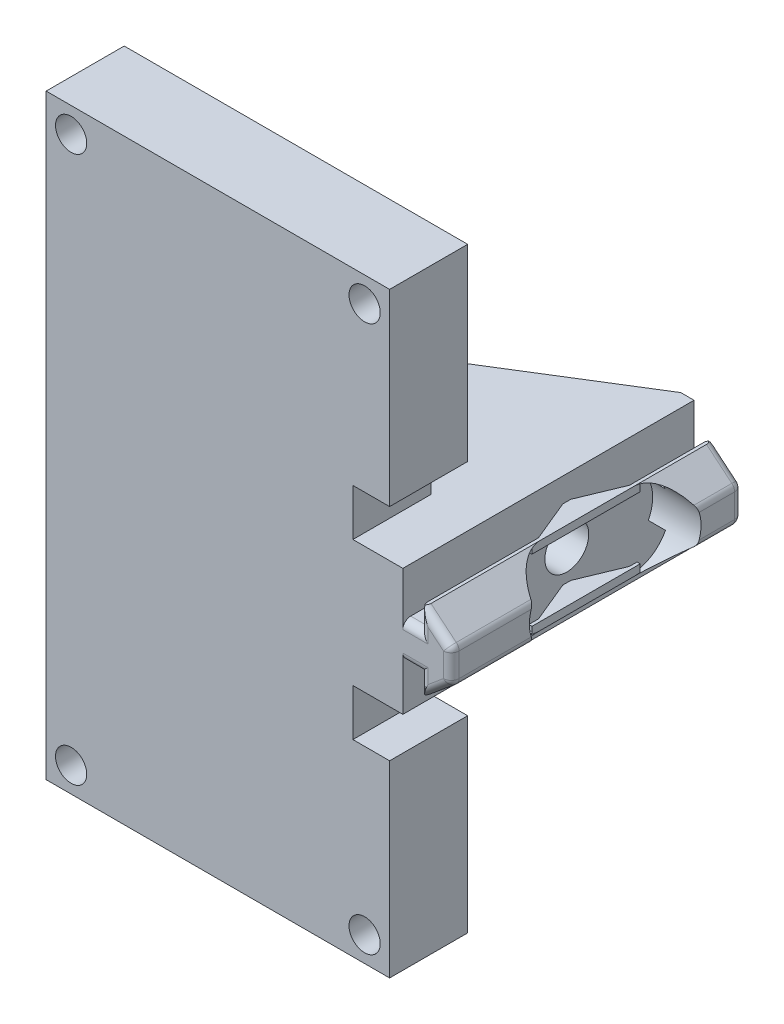
from build123d import *

# Parameters (mm, degrees)
BOSS_EXTRUDE1_DEPTH                              = 47.371
SKETCH2_W                                        = 6.858
SKETCH2_H                                        = 3.429
CUT_EXTRUDE1_DEPTH                               = 49.438972089
SKETCH3_W                                        = 4.064
SKETCH3_H                                        = 47.371
BOSS_EXTRUDE2_DEPTH                              = 7.366
SKETCH4_W                                        = 6.858
SKETCH4_H                                        = 3.429
CUT_EXTRUDE2_DEPTH                               = 50.110425431
SKETCH5_W                                        = 4.064
SKETCH5_H                                        = 47.371
BOSS_EXTRUDE3_DEPTH                              = 7.366
FILLET1_R                                        = 1.27
FILLET3_R                                        = 1.27
FILLET5_R                                        = 1.27
SKETCH15_W                                       = 47.371
SKETCH15_H                                       = 20.574
CUT_EXTRUDE3_DEPTH                               = 1.905
SKETCH16_W                                       = 55.88
SKETCH16_H                                       = 97.028
BOSS_EXTRUDE4_DEPTH                              = 12.7
SKETCH17_R                                       = 2.54
SKETCH17_W                                       = 8.128
SKETCH17_H                                       = 7.62
CUT_EXTRUDE4_DEPTH                               = 90.253265251
BOSS_EXTRUDE5_DEPTH                              = 10.287
BOSS_EXTRUDE5_DEPTH_BACK                         = 10.287
CUT_EXTRUDE5_DEPTH                               = 80.266238887
BOSS_EXTRUDE6_DEPTH                              = 1.27
BOSS_EXTRUDE7_START                              = -12.7
BOSS_EXTRUDE7_DEPTH                              = 1.27
FILLET6_R                                        = 0.254
CBORE_FOR_1_4_BUTTON_HEAD_CAP_SCREW1_D           = 7.14248
CBORE_FOR_1_4_BUTTON_HEAD_CAP_SCREW1_CBORE_D     = 11.90752
CBORE_FOR_1_4_BUTTON_HEAD_CAP_SCREW1_CBORE_DEPTH = 38.1


with BuildPart() as part:
    # Sketch1 → Boss-Extrude1 (new body)
    with BuildSketch(Plane.XY.offset(23.6855)):
        Polygon((3.302, 6.35), (-4.064, 6.35), (-4.064, -6.35), (3.302, -6.35), (7.874, -2.54), (7.874, 2.54), align=None)
    extrude(amount=-BOSS_EXTRUDE1_DEPTH)

    # Sketch2 → Cut-Extrude1 (cut, through all)
    with BuildSketch(Plane.XY.offset(23.6855)):
        with Locations((-0.635, 4.6355)):
            Rectangle(SKETCH2_W, SKETCH2_H)
    extrude(amount=-CUT_EXTRUDE1_DEPTH, mode=Mode.SUBTRACT)

    # Sketch3 → Boss-Extrude2 (add)
    with BuildSketch(Plane(origin=(0, 2.921, 0), x_dir=(-1, 0, 0), z_dir=(0, 1, 0))):
        with Locations((2.032, 0)):
            Rectangle(SKETCH3_W, SKETCH3_H)
    extrude(amount=BOSS_EXTRUDE2_DEPTH)

    # Sketch4 → Cut-Extrude2 (cut, through all)
    with BuildSketch(Plane.XY.offset(23.6855)):
        with Locations((-0.635, -4.6355)):
            Rectangle(SKETCH4_W, SKETCH4_H)
    extrude(amount=-CUT_EXTRUDE2_DEPTH, mode=Mode.SUBTRACT)

    # Sketch5 → Boss-Extrude3 (add)
    with BuildSketch(Plane.XZ.offset(2.921)):
        with Locations((-2.032, 0)):
            Rectangle(SKETCH5_W, SKETCH5_H)
    extrude(amount=BOSS_EXTRUDE3_DEPTH)

    # Fillet1
    fillet1_edges = [part.edges().sort_by_distance(p)[0] for p in [
        (7.874, 2.54, 0),
        (7.874, -2.54, 0),
    ]]
    fillet(fillet1_edges, radius=FILLET1_R)

    # Fillet3
    # the kernel refuses this fillet: 1.27 mm, written as the material it takes off along each edge
    with BuildSketch(Plane(origin=(0.862897437, -8.382585469, -23.6855), x_dir=(-0.6401843996644798, 0.7682212795973759, 0), z_dir=(0.7682212795973759, 0.6401843996644799, 0))) as fillet3_piece_1:
        with BuildLine():
            CenterArc((FILLET3_R, FILLET3_R), FILLET3_R, 180, 90)
            Line((0, FILLET3_R), (0, 0))
            Line((0, 0), (FILLET3_R, 0))
        make_face()
    extrude(amount=8.531574072, mode=Mode.SUBTRACT)
    with BuildSketch(Plane(origin=(6.604, -1.945163819, -23.6855), x_dir=(1, 0, 0), z_dir=(0, 1, 0))) as fillet3_piece_2:
        with BuildLine():
            CenterArc((1.27 - FILLET3_R, -FILLET3_R), FILLET3_R, 0, 90)
            Line((1.27, -FILLET3_R), (1.27, 0))
            Line((1.27, 0), (1.27 - FILLET3_R, 0))
        make_face()
    revolve(axis=Axis((6.604, -1.945163819, -23.6855), (0, 0, -1)), revolution_arc=50.194428908, mode=Mode.SUBTRACT)
    with BuildSketch(Plane(origin=(7.417034188, 2.920804844, -23.6855), x_dir=(0, 0, 1), z_dir=(-0.7682212795973759, 0.6401843996644799, 0))) as fillet3_piece_3:
        with BuildLine():
            CenterArc((FILLET3_R, -FILLET3_R), FILLET3_R, 90, 90)
            Line((0, -FILLET3_R), (0, 0))
            Line((0, 0), (FILLET3_R, 0))
        make_face()
    extrude(amount=8.531574072, mode=Mode.SUBTRACT)
    with BuildSketch(Plane(origin=(6.604, 1.945163819, -23.6855), x_dir=(0.6401843996644799, 0.7682212795973757, 0), z_dir=(-0.7682212795973757, 0.6401843996644799, 0))) as fillet3_piece_4:
        with BuildLine():
            CenterArc((1.27 - FILLET3_R, -FILLET3_R), FILLET3_R, 0, 90)
            Line((1.27 - FILLET3_R, 0), (1.27, 0))
            Line((1.27, 0), (1.27, -FILLET3_R))
        make_face()
    revolve(axis=Axis((6.604, 1.945163819, -23.6855), (0, 0, -1)), revolution_arc=50.194428908, mode=Mode.SUBTRACT)
    with BuildSketch(Plane(origin=(2.794, -2.921, -23.6855), x_dir=(0, 1, 0), z_dir=(-1, 0, 0)), Plane(origin=(0, 2.921, -23.6855), x_dir=(0, -1, 0), z_dir=(1, 0, 0))) as fillet3_piece_5:
        with BuildLine():
            CenterArc((FILLET3_R, -FILLET3_R), FILLET3_R, 90, 90)
            Line((0, -FILLET3_R), (0, 0))
            Line((0, 0), (FILLET3_R, 0))
        make_face()
    extrude(amount=2.794, mode=Mode.SUBTRACT)
    with BuildSketch(Plane(origin=(2.794, 2.921, -23.6855), x_dir=(1, 0, 0), z_dir=(0, 1, 0)), Plane(origin=(2.794, -9.525, -23.6855), x_dir=(1, 0, 0), z_dir=(0, 1, 0))) as fillet3_piece_6:
        with BuildLine():
            CenterArc((FILLET3_R, -FILLET3_R), FILLET3_R, 90, 90)
            Line((0, -FILLET3_R), (0, 0))
            Line((0, 0), (FILLET3_R, 0))
        make_face()
    extrude(amount=6.604, mode=Mode.SUBTRACT)
    with BuildSketch(Plane(origin=(7.874, -1.945163819, -23.6855), x_dir=(-1, 0, 0), z_dir=(0, 1, 0))) as fillet3_piece_7:
        with BuildLine():
            CenterArc((FILLET3_R, FILLET3_R), FILLET3_R, 180, 90)
            Line((0, FILLET3_R), (0, 0))
            Line((0, 0), (FILLET3_R, 0))
        make_face()
    extrude(amount=3.890327637, mode=Mode.SUBTRACT)
    with BuildSketch(Plane(origin=(2.794, -9.525, -23.6855), x_dir=(1, 0, 0), z_dir=(0, 1, 0))) as fillet3_piece_8a_section:
        with BuildLine():
            CenterArc((FILLET3_R, -FILLET3_R), FILLET3_R, 90, 90)
            Line((0, -FILLET3_R), (0, 0))
            Line((0, 0), (FILLET3_R, 0))
        make_face()
    fillet3_piece_8a = extrude(amount=9.779, mode=Mode.PRIVATE)
    fillet3_piece_8a = split(fillet3_piece_8a, bisect_by=Plane(origin=(3.081521795, -2.921, -23.397978205), z_dir=(0, 1, 0)), keep=Keep.TOP, mode=Mode.PRIVATE)
    with BuildSketch(Plane(origin=(5.969, -2.921, -23.6855), x_dir=(0, 1, 0), z_dir=(-1, 0, 0))) as fillet3_piece_8b_section:
        with BuildLine():
            CenterArc((FILLET3_R, -FILLET3_R), FILLET3_R, 90, 90)
            Line((0, -FILLET3_R), (0, 0))
            Line((0, 0), (FILLET3_R, 0))
        make_face()
    fillet3_piece_8b = extrude(amount=5.969, mode=Mode.PRIVATE)
    fillet3_piece_8b = split(fillet3_piece_8b, bisect_by=Plane(origin=(2.794, -2.633478205, -23.397978205), z_dir=(1, 0, 0)), keep=Keep.TOP, mode=Mode.PRIVATE)
    fillet3_piece_8 = fillet3_piece_8a & fillet3_piece_8b
    add(fillet3_piece_8, mode=Mode.SUBTRACT)
    with BuildSketch(Plane(origin=(2.794, -0.254, -23.6855), x_dir=(1, 0, 0), z_dir=(0, 1, 0))) as fillet3_piece_9a_section:
        with BuildLine():
            CenterArc((FILLET3_R, -FILLET3_R), FILLET3_R, 90, 90)
            Line((0, -FILLET3_R), (0, 0))
            Line((0, 0), (FILLET3_R, 0))
        make_face()
    fillet3_piece_9a = extrude(amount=9.779, mode=Mode.PRIVATE)
    fillet3_piece_9a = split(fillet3_piece_9a, bisect_by=Plane(origin=(3.081521795, 2.921, -23.397978205), z_dir=(0, -1, 0)), keep=Keep.TOP, mode=Mode.PRIVATE)
    with BuildSketch(Plane(origin=(0, 2.921, -23.6855), x_dir=(0, -1, 0), z_dir=(1, 0, 0))) as fillet3_piece_9b_section:
        with BuildLine():
            CenterArc((FILLET3_R, -FILLET3_R), FILLET3_R, 90, 90)
            Line((0, -FILLET3_R), (0, 0))
            Line((0, 0), (FILLET3_R, 0))
        make_face()
    fillet3_piece_9b = extrude(amount=5.969, mode=Mode.PRIVATE)
    fillet3_piece_9b = split(fillet3_piece_9b, bisect_by=Plane(origin=(2.794, 2.633478205, -23.397978205), z_dir=(1, 0, 0)), keep=Keep.TOP, mode=Mode.PRIVATE)
    fillet3_piece_9 = fillet3_piece_9a & fillet3_piece_9b
    add(fillet3_piece_9, mode=Mode.SUBTRACT)

    # Fillet5
    # the kernel refuses this fillet: 1.27 mm, written as the material it takes off along each edge
    with BuildSketch(Plane(origin=(0.862897437, -8.382585469, 23.6855), x_dir=(0, 0, -1), z_dir=(0.7682212795973759, 0.6401843996644799, 0)), Plane(origin=(7.417034188, 2.920804844, 23.6855), x_dir=(0, 0, -1), z_dir=(-0.7682212795973759, 0.6401843996644799, 0))) as fillet5_piece_1:
        with BuildLine():
            CenterArc((FILLET5_R, FILLET5_R), FILLET5_R, 180, 90)
            Line((0, FILLET5_R), (0, 0))
            Line((0, 0), (FILLET5_R, 0))
        make_face()
    extrude(amount=8.531574072, mode=Mode.SUBTRACT)
    with BuildSketch(Plane(origin=(6.604, -1.945163819, 23.6855), x_dir=(1, 0, 0), z_dir=(0, 1, 0))) as fillet5_piece_2:
        with BuildLine():
            CenterArc((1.27 - FILLET5_R, FILLET5_R), FILLET5_R, 270, 90)
            Line((1.27 - FILLET5_R, 0), (1.27, 0))
            Line((1.27, 0), (1.27, FILLET5_R))
        make_face()
    revolve(axis=Axis((6.604, -1.945163819, 23.6855), (0, 0, -1)), revolution_arc=50.194428908, mode=Mode.SUBTRACT)
    with BuildSketch(Plane(origin=(6.604, 1.945163819, 23.6855), x_dir=(0.6401843996644799, 0.7682212795973757, 0), z_dir=(-0.7682212795973757, 0.6401843996644799, 0))) as fillet5_piece_3:
        with BuildLine():
            CenterArc((1.27 - FILLET5_R, FILLET5_R), FILLET5_R, 270, 90)
            Line((1.27 - FILLET5_R, 0), (1.27, 0))
            Line((1.27, 0), (1.27, FILLET5_R))
        make_face()
    revolve(axis=Axis((6.604, 1.945163819, 23.6855), (0, 0, -1)), revolution_arc=50.194428908, mode=Mode.SUBTRACT)
    with BuildSketch(Plane(origin=(2.794, 2.921, 23.6855), x_dir=(0, 0, -1), z_dir=(0, 1, 0)), Plane(origin=(2.794, -9.525, 23.6855), x_dir=(0, 0, -1), z_dir=(0, 1, 0))) as fillet5_piece_4:
        with BuildLine():
            CenterArc((FILLET5_R, -FILLET5_R), FILLET5_R, 90, 90)
            Line((0, -FILLET5_R), (0, 0))
            Line((0, 0), (FILLET5_R, 0))
        make_face()
    extrude(amount=6.604, mode=Mode.SUBTRACT)
    with BuildSketch(Plane(origin=(0, 2.921, 23.6855), x_dir=(0, 0, -1), z_dir=(1, 0, 0)), Plane(origin=(2.794, -2.921, 23.6855), x_dir=(0, 0, -1), z_dir=(-1, 0, 0))) as fillet5_piece_5:
        with BuildLine():
            CenterArc((FILLET5_R, -FILLET5_R), FILLET5_R, 90, 90)
            Line((0, -FILLET5_R), (0, 0))
            Line((0, 0), (FILLET5_R, 0))
        make_face()
    extrude(amount=2.794, mode=Mode.SUBTRACT)
    with BuildSketch(Plane(origin=(7.874, -1.945163819, 23.6855), x_dir=(0, 0, -1), z_dir=(0, 1, 0))) as fillet5_piece_6:
        with BuildLine():
            CenterArc((FILLET5_R, FILLET5_R), FILLET5_R, 180, 90)
            Line((0, FILLET5_R), (0, 0))
            Line((0, 0), (FILLET5_R, 0))
        make_face()
    extrude(amount=3.890327637, mode=Mode.SUBTRACT)
    with BuildSketch(Plane(origin=(0, 2.921, 23.6855), x_dir=(0, 0, -1), z_dir=(1, 0, 0))) as fillet5_piece_7a_section:
        with BuildLine():
            CenterArc((FILLET5_R, -FILLET5_R), FILLET5_R, 90, 90)
            Line((0, -FILLET5_R), (0, 0))
            Line((0, 0), (FILLET5_R, 0))
        make_face()
    fillet5_piece_7a = extrude(amount=5.969, mode=Mode.PRIVATE)
    fillet5_piece_7a = split(fillet5_piece_7a, bisect_by=Plane(origin=(2.794, 2.633478205, 23.397978205), z_dir=(1, 0, 0)), keep=Keep.TOP, mode=Mode.PRIVATE)
    with BuildSketch(Plane(origin=(2.794, -0.254, 23.6855), x_dir=(0, 0, -1), z_dir=(0, 1, 0))) as fillet5_piece_7b_section:
        with BuildLine():
            CenterArc((FILLET5_R, -FILLET5_R), FILLET5_R, 90, 90)
            Line((0, -FILLET5_R), (0, 0))
            Line((0, 0), (FILLET5_R, 0))
        make_face()
    fillet5_piece_7b = extrude(amount=9.779, mode=Mode.PRIVATE)
    fillet5_piece_7b = split(fillet5_piece_7b, bisect_by=Plane(origin=(3.081521795, 2.921, 23.397978205), z_dir=(0, -1, 0)), keep=Keep.TOP, mode=Mode.PRIVATE)
    fillet5_piece_7 = fillet5_piece_7a & fillet5_piece_7b
    add(fillet5_piece_7, mode=Mode.SUBTRACT)
    with BuildSketch(Plane(origin=(2.794, -9.525, 23.6855), x_dir=(0, 0, -1), z_dir=(0, 1, 0))) as fillet5_piece_8a_section:
        with BuildLine():
            CenterArc((FILLET5_R, -FILLET5_R), FILLET5_R, 90, 90)
            Line((0, -FILLET5_R), (0, 0))
            Line((0, 0), (FILLET5_R, 0))
        make_face()
    fillet5_piece_8a = extrude(amount=9.779, mode=Mode.PRIVATE)
    fillet5_piece_8a = split(fillet5_piece_8a, bisect_by=Plane(origin=(3.081521795, -2.921, 23.397978205), z_dir=(0, 1, 0)), keep=Keep.TOP, mode=Mode.PRIVATE)
    with BuildSketch(Plane(origin=(5.969, -2.921, 23.6855), x_dir=(0, 0, -1), z_dir=(-1, 0, 0))) as fillet5_piece_8b_section:
        with BuildLine():
            CenterArc((FILLET5_R, -FILLET5_R), FILLET5_R, 90, 90)
            Line((0, -FILLET5_R), (0, 0))
            Line((0, 0), (FILLET5_R, 0))
        make_face()
    fillet5_piece_8b = extrude(amount=5.969, mode=Mode.PRIVATE)
    fillet5_piece_8b = split(fillet5_piece_8b, bisect_by=Plane(origin=(2.794, -2.633478205, 23.397978205), z_dir=(1, 0, 0)), keep=Keep.TOP, mode=Mode.PRIVATE)
    fillet5_piece_8 = fillet5_piece_8a & fillet5_piece_8b
    add(fillet5_piece_8, mode=Mode.SUBTRACT)

    # Sketch15 → Cut-Extrude3 (cut)
    with BuildSketch(Plane.ZY.offset(4.064)):
        Rectangle(SKETCH15_W, SKETCH15_H)
    extrude(amount=-CUT_EXTRUDE3_DEPTH, mode=Mode.SUBTRACT)

    # Sketch16 → Boss-Extrude4 (add)
    with BuildSketch(Plane.XY.offset(23.6855)):
        with Locations((-30.099, 0)):
            Rectangle(SKETCH16_W, SKETCH16_H)
    extrude(amount=-BOSS_EXTRUDE4_DEPTH)

    # Sketch17 → Cut-Extrude4 (cut, through all)
    with BuildSketch(Plane.XY.offset(23.6855)):
        with Locations((-53.975, 44.45)):
            Circle(SKETCH17_R)
        with Locations((-6.223, 44.45)):
            Circle(SKETCH17_R)
        with Locations((-6.223, -44.45)):
            Circle(SKETCH17_R)
        with Locations((-53.975, -44.45)):
            Circle(SKETCH17_R)
        with Locations((-4.064, 14.097)):
            Rectangle(SKETCH17_W, SKETCH17_H)
        with Locations((-4.064, -14.097)):
            Rectangle(SKETCH17_W, SKETCH17_H)
    extrude(amount=-CUT_EXTRUDE4_DEPTH, mode=Mode.SUBTRACT)

    # Sketch18 → Boss-Extrude5 (add, two sides: drawn at the far end of the back side and taken through both)
    with BuildSketch(Plane(origin=(0, 0, 0), x_dir=(1, 0, 0), z_dir=(0, 1, 0)).offset(-BOSS_EXTRUDE5_DEPTH_BACK)):
        Polygon((-2.159, 23.6855), (-58.039, -10.9855), (-2.159, -10.9855), align=None)
    extrude(amount=BOSS_EXTRUDE5_DEPTH + BOSS_EXTRUDE5_DEPTH_BACK)

    # Sketch19 → Cut-Extrude5 (cut, through all)
    with BuildSketch(Plane(origin=(0, 0, 0), x_dir=(0, 0, -1), z_dir=(1, 0, 0))):
        with BuildLine():
            Line((-4.6355, 6.35), (10.6045, 6.35))
            ThreePointArc((10.6045, 6.35), (16.9545, 0), (10.6045, -6.35))
            Line((10.6045, -6.35), (-4.6355, -6.35))
            ThreePointArc((-4.6355, -6.35), (-10.9855, 0), (-4.6355, 6.35))
        make_face()
    extrude(amount=CUT_EXTRUDE5_DEPTH, mode=Mode.SUBTRACT)

    # Sketch21 → Boss-Extrude6 (add)
    with BuildSketch(Plane.XZ.offset(6.35)):
        Polygon((2.794, 5.988795772), (3.302, 5.988795772), (3.302, -11.61557836), (2.794, -11.61557836), (2.794, -10.386589214), (-0.272045742, -2.9845), (2.794, 4.417589214), align=None)
    extrude(amount=-BOSS_EXTRUDE6_DEPTH)

    # Sketch21<3> → Boss-Extrude7 (add)
    with BuildSketch(Plane.XZ.offset(6.35).offset(BOSS_EXTRUDE7_START)):
        Polygon((2.794, 5.988795772), (3.302, 5.988795772), (3.302, -11.61557836), (2.794, -11.61557836), (2.794, -10.386589214), (-0.272045742, -2.9845), (2.794, 4.417589214), align=None)
    extrude(amount=BOSS_EXTRUDE7_DEPTH)

    # Fillet6
    fillet6_edges = [part.edges().sort_by_distance(p)[0] for p in [
        (3.048, -6.204118838, 5.988795772),
        (3.048, 6.204118838, 5.988795772),
    ]]
    fillet(fillet6_edges, radius=FILLET6_R)

    # CBORE for 1/4 Button Head Cap Screw1 (through all)
    with Locations(Plane(origin=(-50.8, 0, 0), x_dir=(0, 0, -1), z_dir=(-1, 0, 0))):
        with Locations((2.9845, 0)):
            CounterBoreHole(CBORE_FOR_1_4_BUTTON_HEAD_CAP_SCREW1_D / 2, CBORE_FOR_1_4_BUTTON_HEAD_CAP_SCREW1_CBORE_D / 2, CBORE_FOR_1_4_BUTTON_HEAD_CAP_SCREW1_CBORE_DEPTH)


solid = part.part
